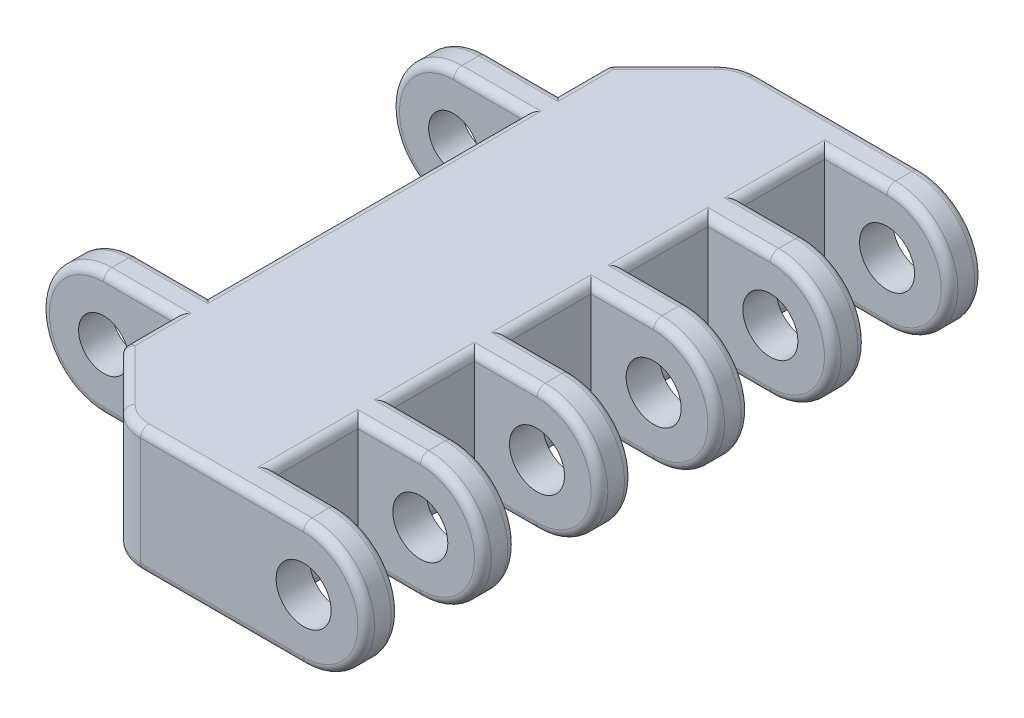
from build123d import *

# Parameters (mm, degrees)
SKETCH3_R                            = 4.191
BASE_GROOVE_EXTRUDE_DEPTH            = 5.08
GROOVE_PATTERN_COUNT                 = 6
GROOVE_PATTERN_PITCH                 = 17.78
UPPERFOOT_START                      = 71.12
SKETCH3_8_R                          = 3.81
UPPERFOOT_CONNECTION_EXTRUDE_1_DEPTH = 5.08
UPPERFOOT_START_2                    = 17.78
SKETCH3_9_R                          = 3.81
UPPERFOOT_CONNECTION_EXTRUDE_2_DEPTH = 5.08
BODY_EXTRUDE_DEPTH                   = 93.98
CHAMFER1_SIZE                        = 10
FILLET25_R                           = 1.27
FILLET26_R                           = 6.35


with BuildPart() as part:
    # Sketch3 → Base Groove Extrude (new body)
    with BuildSketch(Plane.XY):
        with BuildLine():
            ThreePointArc((0, -9.525), (9.525, 0), (0, 9.525))
            Line((0, 9.525), (-37.465, 9.525))
            Line((-37.465, 9.525), (-37.465, -9.525))
            Line((-37.465, -9.525), (0, -9.525))
        make_face()
        Circle(SKETCH3_R, mode=Mode.SUBTRACT)
    extrude(amount=BASE_GROOVE_EXTRUDE_DEPTH)


with BuildPart() as groove_pattern_1:
    # Groove Pattern: pattern copy
    add(part.part.moved(Location(Vector(0, 0, 1) * (1 * GROOVE_PATTERN_PITCH))))

    # Sketch3<9> → Upperfoot Connection Extrude 2 (add)
    with BuildSketch(Plane.XY.offset(UPPERFOOT_START_2)):
        with BuildLine():
            Line((-37.465, 9.525), (-48.26, 9.525))
            ThreePointArc((-48.26, 9.525), (-57.785, 0), (-48.26, -9.525))
            Line((-48.26, -9.525), (-37.465, -9.525))
            Line((-37.465, -9.525), (-37.465, 9.525))
        make_face()
        with Locations((-48.26, 0)):
            Circle(SKETCH3_9_R, mode=Mode.SUBTRACT)
    extrude(amount=UPPERFOOT_CONNECTION_EXTRUDE_2_DEPTH)


with BuildPart() as groove_pattern_2:
    # Groove Pattern: pattern copy
    add(part.part.moved(Location(Vector(0, 0, 1) * (2 * GROOVE_PATTERN_PITCH))))


with BuildPart() as groove_pattern_3:
    # Groove Pattern: pattern copy
    add(part.part.moved(Location(Vector(0, 0, 1) * (3 * GROOVE_PATTERN_PITCH))))


with BuildPart() as groove_pattern_4:
    # Groove Pattern: pattern copy
    add(part.part.moved(Location(Vector(0, 0, 1) * (4 * GROOVE_PATTERN_PITCH))))

    # Sketch3<8> → Upperfoot Connection Extrude 1 (add)
    with BuildSketch(Plane.XY.offset(UPPERFOOT_START)):
        with BuildLine():
            Line((-37.465, 9.525), (-48.26, 9.525))
            ThreePointArc((-48.26, 9.525), (-57.785, 0), (-48.26, -9.525))
            Line((-48.26, -9.525), (-37.465, -9.525))
            Line((-37.465, -9.525), (-37.465, 9.525))
        make_face()
        with Locations((-48.26, 0)):
            Circle(SKETCH3_8_R, mode=Mode.SUBTRACT)
    extrude(amount=UPPERFOOT_CONNECTION_EXTRUDE_1_DEPTH)


with BuildPart() as groove_pattern_5:
    # Groove Pattern: pattern copy
    add(part.part.moved(Location(Vector(0, 0, 1) * (5 * GROOVE_PATTERN_PITCH))))


with BuildPart() as part_1:
    add(part.part)

    add(groove_pattern_1.part)  # Body Extrude merges Groove Pattern_1

    add(groove_pattern_2.part)  # Body Extrude merges Groove Pattern_2

    add(groove_pattern_3.part)  # Body Extrude merges Groove Pattern_3

    add(groove_pattern_4.part)  # Body Extrude merges Groove Pattern_4

    add(groove_pattern_5.part)  # Body Extrude merges Groove Pattern_5
    # Sketch3<10> → Body Extrude (add)
    with BuildSketch(Plane.XY):
        Polygon((-9.525, -4.2e-08), (-9.525, 9.525), (-37.465, 9.525), (-37.465, 0), (-37.465, -9.525), (-9.525, -9.525), align=None)
    extrude(amount=BODY_EXTRUDE_DEPTH)

    # Chamfer1
    chamfer1_edges = [part_1.edges().sort_by_distance(p)[0] for p in [
        (-37.465, 0, 93.98),
        (-37.465, 0, 0),
    ]]
    chamfer(chamfer1_edges, length=CHAMFER1_SIZE)

    # Fillet25
    fillet25_edges = [part_1.edges().sort_by_distance(p)[0] for p in [
        (-37.465, 9.525, 13.89),
        (-37.465, -9.525, 13.89),
        (-9.525, 9.525, 11.43),
        (-9.525, -9.525, 11.43),
        (-4.7625, -9.525, 22.86),
        (-4.7625, 9.525, 17.78),
        (9.525, 0, 22.86),
        (-4.7625, 9.525, 22.86),
        (-4.7625, -9.525, 17.78),
        (-42.8625, -9.525, 22.86),
        (9.525, 0, 17.78),
        (-42.8625, 9.525, 17.78),
        (-42.8625, 9.525, 22.86),
        (-57.785, 0, 22.86),
        (-42.8625, -9.525, 17.78),
        (-57.785, 0, 17.78),
        (9.525, 0, 5.08),
        (-37.465, -9.525, 46.99),
        (-37.465, 9.525, 46.99),
        (-9.525, 9.525, 64.77),
        (-9.525, -9.525, 64.77),
        (-4.7625, -9.525, 76.2),
        (-4.7625, 9.525, 71.12),
        (9.525, 0, 76.2),
        (-4.7625, 9.525, 76.2),
        (-4.7625, -9.525, 71.12),
        (-42.8625, -9.525, 76.2),
        (9.525, 0, 71.12),
        (-42.8625, 9.525, 71.12),
        (-42.8625, 9.525, 76.2),
        (-57.785, 0, 76.2),
        (-42.8625, -9.525, 71.12),
        (-57.785, 0, 71.12),
        (-4.7625, 9.525, 5.08),
        (-37.465, 9.525, 80.09),
        (-32.465, 9.525, 88.98),
        (-32.465, 9.525, 5),
        (-37.465, 0, 10),
        (-37.465, -9.525, 80.09),
        (-32.465, -9.525, 88.98),
        (-32.465, -9.525, 5),
        (-37.465, 0, 83.98),
        (-13.7325, 9.525, 93.98),
        (-13.7325, -9.525, 93.98),
        (-9.525, 9.525, 29.21),
        (-9.525, -9.525, 29.21),
        (-4.7625, -9.525, 40.64),
        (-4.7625, 9.525, 35.56),
        (9.525, 0, 40.64),
        (-4.7625, 9.525, 40.64),
        (-4.7625, -9.525, 35.56),
        (9.525, 0, 35.56),
        (-4.7625, -9.525, 5.08),
        (-9.525, -9.525, 46.99),
        (-9.525, 9.525, 46.99),
        (-4.7625, -9.525, 58.42),
        (-4.7625, 9.525, 53.34),
        (9.525, 0, 58.42),
        (-4.7625, 9.525, 58.42),
        (-4.7625, -9.525, 53.34),
        (9.525, 0, 53.34),
        (-13.7325, 9.525, 0),
        (-9.525, -9.525, 82.55),
        (-9.525, 9.525, 82.55),
        (9.525, 0, 0),
        (-4.7625, 9.525, 88.9),
        (9.525, 0, 93.98),
        (-4.7625, -9.525, 88.9),
        (9.525, 0, 88.9),
        (-13.7325, -9.525, 0),
    ]]
    fillet(fillet25_edges, radius=FILLET25_R)

    # Fillet26
    # the kernel refuses this fillet: 6.35 mm, written as the material it takes off along each edge
    with BuildSketch(Plane(origin=(-24.834743879, -9.525, 87.63), x_dir=(0, 0, 1), z_dir=(1, 0, 0))) as fillet26_piece_1:
        with BuildLine():
            CenterArc((5.08, -1.27), 1.27, 0, 90)
            Line((6.35, -1.27), (6.35, 0))
            Line((6.35, 0), (5.08, 0))
        make_face()
    revolve(axis=Axis((-24.834743879, -9.525, 87.63), (0, -1, 0)), revolution_arc=45, mode=Mode.SUBTRACT)
    with BuildSketch(Plane(origin=(-24.834743879, 9.525, 87.63), x_dir=(-0.7071067811865476, 0, 0.7071067811865476), z_dir=(-0.7071067811865476, 0, -0.7071067811865476))) as fillet26_piece_2:
        with BuildLine():
            CenterArc((5.08, -1.27), 1.27, 0, 90)
            Line((6.35, -1.27), (6.35, 0))
            Line((6.35, 0), (5.08, 0))
        make_face()
    revolve(axis=Axis((-24.834743879, 9.525, 87.63), (0, 1, 0)), revolution_arc=45, mode=Mode.SUBTRACT)
    with BuildSketch(Plane(origin=(-24.834743879, 9.525, 6.35), x_dir=(0, 0, -1), z_dir=(1, 0, 0))) as fillet26_piece_3:
        with BuildLine():
            CenterArc((5.08, -1.27), 1.27, 0, 90)
            Line((6.35, -1.27), (6.35, 0))
            Line((6.35, 0), (5.08, 0))
        make_face()
    revolve(axis=Axis((-24.834743879, 9.525, 6.35), (0, 1, 0)), revolution_arc=45, mode=Mode.SUBTRACT)
    with BuildSketch(Plane(origin=(-24.834743879, -9.525, 6.35), x_dir=(-0.7071067811865476, 0, -0.7071067811865476), z_dir=(-0.7071067811865476, 0, 0.7071067811865476))) as fillet26_piece_4:
        with BuildLine():
            CenterArc((5.08, -1.27), 1.27, 0, 90)
            Line((6.35, -1.27), (6.35, 0))
            Line((6.35, 0), (5.08, 0))
        make_face()
    revolve(axis=Axis((-24.834743879, -9.525, 6.35), (0, -1, 0)), revolution_arc=45, mode=Mode.SUBTRACT)
    with BuildSketch(Plane(origin=(-27.465, 9.525, 93.98), x_dir=(1, 0, 0), z_dir=(0, -1, 0)), Plane(origin=(-27.465, 9.525, 0), x_dir=(-0.7071067811865476, 0, 0.7071067811865476), z_dir=(0, -1, 0))) as fillet26_piece_5:
        with BuildLine():
            CenterArc((FILLET26_R * 0.414213562373, -FILLET26_R), FILLET26_R, 90, 45)
            Line((-FILLET26_R * 0.292893218813, -FILLET26_R * 0.292893218813), (0, 0))
            Line((0, 0), (FILLET26_R * 0.414213562373, 0))
        make_face()
    extrude(amount=19.05, mode=Mode.SUBTRACT)


solid = part_1.part
